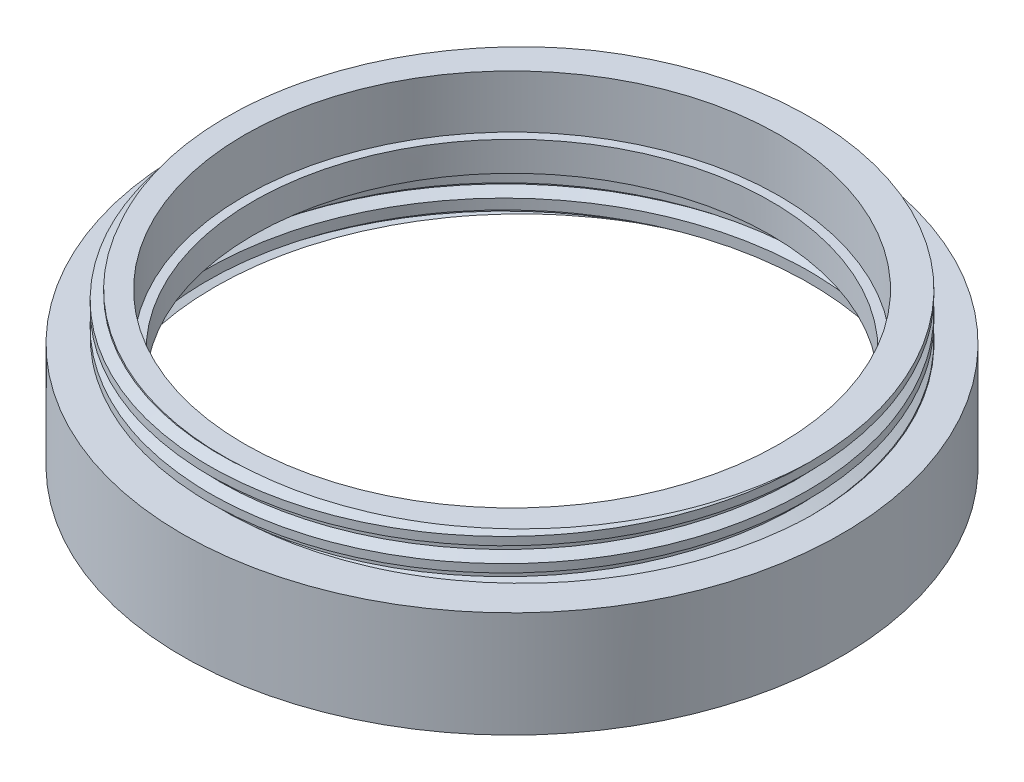
from build123d import *

# Parameters (mm, degrees)
SKETCH1_R           = 28
BOSS_EXTRUDE1_DEPTH = 2
SKETCH2_R           = 28
SKETCH2_R_2         = 22.74
SKETCH2_R_3         = 12.125
BOSS_EXTRUDE2_DEPTH = 15
SKETCH4_W           = 9
SKETCH4_H           = 5
CUT_EXTRUDE1_DEPTH  = 43.343830719
CUT_EXTRUDE2_START  = -5
SKETCH11_R          = 28
SKETCH11_R_2        = 25.35
CUT_EXTRUDE2_DEPTH  = 5
THREAD3_PITCH       = 2
SKETCH14_R          = 28
CUT_EXTRUDE3_DEPTH  = 2
SKETCH15_R          = 12.125
CUT_EXTRUDE4_DEPTH  = 43.343830887
SKETCH16_R          = 28
SKETCH16_R_2        = 22.74
CUT_EXTRUDE5_DEPTH  = 1
SKETCH17_R          = 28
CUT_EXTRUDE6_DEPTH  = 1
SKETCH18_R          = 28
SKETCH18_R_2        = 22.74
BOSS_EXTRUDE5_DEPTH = 3
SKETCH19_R          = 25.59
SKETCH19_R_2        = 22.74
CUT_EXTRUDE7_DEPTH  = 6
THREAD4_PITCH       = 2
SKETCH24_R          = 22.7625
SKETCH24_R_2        = 21.99
BOSS_EXTRUDE7_DEPTH = 2.5


with BuildPart() as part:
    # Sketch1 → Boss-Extrude1 (new body)
    with BuildSketch(Plane(origin=(0, 0, 0), x_dir=(1, 0, 0), z_dir=(0, 1, 0))):
        with Locations(Location((0, 0, 0), (0, 0, 270))):
            Circle(SKETCH1_R)
    extrude(amount=BOSS_EXTRUDE1_DEPTH)

    # Sketch2 → Boss-Extrude2 (add)
    # profile 1 of 2: a face of its own
    with BuildSketch(Plane(origin=(0, 2, 0), x_dir=(1, 0, 0), z_dir=(0, 1, 0))):
        with Locations(Location((0, 0, 0), (0, 0, 270))):
            Circle(SKETCH2_R)
        with Locations(Location((0, 0, 0), (0, 0, 270))):
            Circle(SKETCH2_R_2, mode=Mode.SUBTRACT)
    # profile 2 of 2: a face of its own
    with BuildSketch(Plane(origin=(0, 2, 0), x_dir=(1, 0, 0), z_dir=(0, 1, 0))):
        with Locations(Location((0, 0, 0), (0, 0, 270))):
            Circle(SKETCH2_R_3)
    extrude(amount=BOSS_EXTRUDE2_DEPTH)

    # Sketch4 → Cut-Extrude1 (cut, through all)
    with BuildSketch(Plane(origin=(0, 2, 0), x_dir=(1, 0, 0), z_dir=(0, 1, 0))):
        with Locations((16.625, 0)):
            Rectangle(SKETCH4_W, SKETCH4_H)
    extrude(amount=-CUT_EXTRUDE1_DEPTH, mode=Mode.SUBTRACT)

    # Sketch11 → Cut-Extrude2 (cut)
    with BuildSketch(Plane(origin=(0, 17, 0), x_dir=(1, 0, 0), z_dir=(0, 1, 0)).offset(CUT_EXTRUDE2_START)):
        with Locations(Location((0, 0, 0), (0, 0, 270))):
            Circle(SKETCH11_R)
        with Locations(Location((0, 0, 0), (0, 0, 270))):
            Circle(SKETCH11_R_2, mode=Mode.SUBTRACT)
    extrude(amount=CUT_EXTRUDE2_DEPTH, mode=Mode.SUBTRACT)

    # Thread3: arcs per turn and ends read off the stored shape
    # Thread3: the profile of Thread Profile3 profile screwed along a right-hand helix through 3.5 turns, 10 arcs to a turn; built about Z, then put on its axis
    thread3_z = Axis((0, 0, 0), (0, 0, 1))
    thread3_corners = [(-25.3503, 0, -7.000173205), (-25.3503, 0, -5.687326799), (-24.538101188, 0, -6.156250002), (-24.538101188, 0, -6.531250002)]
    with BuildLine(mode=Mode.PRIVATE) as thread3_profile:
        Line(thread3_corners[0], thread3_corners[1])
        Line(thread3_corners[1], thread3_corners[2])
        Line(thread3_corners[2], thread3_corners[3])
        Line(thread3_corners[3], thread3_corners[0])
    thread3_cap = Face(thread3_profile.wire())
    thread3_turn_angles = [0, 18, 36, 54, 72, 90, 108, 126, 144, 162, 180, 198, 216, 234, 252, 270, 288, 306, 324, 342, 360]
    thread3_turn_weights = [1, 0.9510565162951535, 1, 0.9510565162951535, 1, 0.9510565162951535, 1, 0.9510565162951535, 1, 0.9510565162951535, 1, 0.9510565162951535, 1, 0.9510565162951535, 1, 0.9510565162951535, 1, 0.9510565162951535, 1, 0.9510565162951535, 1]
    thread3_turn_rails = [Edge.make_bspline([Vector(p[0], p[1], 0).rotate(thread3_z, thread3_turn_angles[k]) / thread3_turn_weights[k] + Vector(0, 0, p[2] + THREAD3_PITCH * thread3_turn_angles[k] / 360) for k in range(21)], [0, 0, 0, 1, 1, 2, 2, 3, 3, 4, 4, 5, 5, 6, 6, 7, 7, 8, 8, 9, 9, 10, 10, 10], 2, thread3_turn_weights) for p in thread3_corners]
    thread3_turn_sides = [Face.make_surface_from_curves(thread3_turn_rails[p[0]], thread3_turn_rails[p[1]]) for p in [(0, 1), (1, 2), (2, 3), (3, 0)]]
    thread3_last_angles = [1080, 1098, 1116, 1134, 1152, 1170, 1188, 1206, 1224, 1242, 1260]
    thread3_last_weights = [1, 0.9510565162951535, 1, 0.9510565162951535, 1, 0.9510565162951535, 1, 0.9510565162951535, 1, 0.9510565162951535, 1]
    thread3_last_rails = [Edge.make_bspline([Vector(p[0], p[1], 0).rotate(thread3_z, thread3_last_angles[k]) / thread3_last_weights[k] + Vector(0, 0, p[2] + THREAD3_PITCH * thread3_last_angles[k] / 360) for k in range(11)], [0, 0, 0, 1, 1, 2, 2, 3, 3, 4, 4, 5, 5, 5], 2, thread3_last_weights) for p in thread3_corners]
    thread3_last_sides = [Face.make_surface_from_curves(thread3_last_rails[p[0]], thread3_last_rails[p[1]]) for p in [(0, 1), (1, 2), (2, 3), (3, 0)]]
    thread3 = Plane(origin=(0, 17, 0), x_dir=(-1, 0, 0), z_dir=(0, 1, 0)) * Solid(Shell([*[p.moved(Location((0, 0, THREAD3_PITCH * i))) for i in range(3) for p in thread3_turn_sides], *thread3_last_sides, thread3_cap, thread3_cap.rotate(thread3_z, 1260).moved(Location((0, 0, THREAD3_PITCH * 1260 / 360)))]))
    add(thread3, mode=Mode.SUBTRACT)

    # Sketch14 → Cut-Extrude3 (cut)
    with BuildSketch(Plane.XZ):
        with Locations(Location((0, 0, 0), (0, 0, 270))):
            Circle(SKETCH14_R)
    extrude(amount=-CUT_EXTRUDE3_DEPTH, mode=Mode.SUBTRACT)


with BuildPart() as cut_extrude3_piece_1:
    # of the separate pieces the step leaves, piece 1, a body of its own (cut_extrude3_pieces)
    add(part.part.solids().sort_by_distance((0, 12, 28))[0])

    # Sketch16 → Cut-Extrude5 (cut)
    with BuildSketch(Plane.XZ.offset(-2)):
        with Locations(Location((0, 0, 0), (0, 0, 270))):
            Circle(SKETCH16_R)
        with Locations(Location((0, 0, 0), (0, 0, 270))):
            Circle(SKETCH16_R_2, mode=Mode.SUBTRACT)
    extrude(amount=-CUT_EXTRUDE5_DEPTH, mode=Mode.SUBTRACT)

    # Sketch17 → Cut-Extrude6 (cut)
    with BuildSketch(Plane(origin=(0, 17, 0), x_dir=(1, 0, 0), z_dir=(0, 1, 0))):
        with Locations(Location((0, 0, 0), (0, 0, 90))):
            Circle(SKETCH17_R)
    extrude(amount=-CUT_EXTRUDE6_DEPTH, mode=Mode.SUBTRACT)

    # Sketch18 → Boss-Extrude5 (add)
    with BuildSketch(Plane(origin=(0, 12, 0), x_dir=(1, 0, 0), z_dir=(0, 1, 0))):
        with Locations(Location((0, 0, 0), (0, 0, 90))):
            Circle(SKETCH18_R)
        with Locations(Location((0, 0, 0), (0, 0, 90))):
            Circle(SKETCH18_R_2, mode=Mode.SUBTRACT)
    extrude(amount=-BOSS_EXTRUDE5_DEPTH)

    # Sketch19 → Cut-Extrude7 (cut)
    with BuildSketch(Plane.XZ.offset(-3)):
        with Locations(Location((0, 0, 0), (0, 0, 270))):
            Circle(SKETCH19_R)
        with Locations(Location((0, 0, 0), (0, 0, 270))):
            Circle(SKETCH19_R_2, mode=Mode.SUBTRACT)
    extrude(amount=-CUT_EXTRUDE7_DEPTH, mode=Mode.SUBTRACT)

    # Thread4: arcs per turn and ends read off the stored shape
    # Thread4: the profile of Thread Profile4 profile screwed along a right-hand helix through 3 turns, 10 arcs to a turn; built about Z, then put on its axis
    thread4_z = Axis((0, 0, 0), (0, 0, 1))
    thread4_corners = [(25.5897, 0, -6.000173205), (26.401898813, 0, -5.531250002), (26.401898813, 0, -5.343750002), (25.5897, 0, -4.874826799)]
    with BuildLine(mode=Mode.PRIVATE) as thread4_profile:
        Line(thread4_corners[0], thread4_corners[1])
        Line(thread4_corners[1], thread4_corners[2])
        Line(thread4_corners[2], thread4_corners[3])
        Line(thread4_corners[3], thread4_corners[0])
    thread4_cap = Face(thread4_profile.wire())
    thread4_turn_angles = [0, 18, 36, 54, 72, 90, 108, 126, 144, 162, 180, 198, 216, 234, 252, 270, 288, 306, 324, 342, 360]
    thread4_turn_weights = [1, 0.9510565162951535, 1, 0.9510565162951535, 1, 0.9510565162951535, 1, 0.9510565162951535, 1, 0.9510565162951535, 1, 0.9510565162951535, 1, 0.9510565162951535, 1, 0.9510565162951535, 1, 0.9510565162951535, 1, 0.9510565162951535, 1]
    thread4_turn_rails = [Edge.make_bspline([Vector(p[0], p[1], 0).rotate(thread4_z, thread4_turn_angles[k]) / thread4_turn_weights[k] + Vector(0, 0, p[2] + THREAD4_PITCH * thread4_turn_angles[k] / 360) for k in range(21)], [0, 0, 0, 1, 1, 2, 2, 3, 3, 4, 4, 5, 5, 6, 6, 7, 7, 8, 8, 9, 9, 10, 10, 10], 2, thread4_turn_weights) for p in thread4_corners]
    thread4_turn_sides = [Face.make_surface_from_curves(thread4_turn_rails[p[0]], thread4_turn_rails[p[1]]) for p in [(0, 1), (1, 2), (2, 3), (3, 0)]]
    thread4 = Plane(origin=(0, 3, 0), x_dir=(1, 0, 0), z_dir=(0, -1, 0)) * Solid(Shell([*[p.moved(Location((0, 0, THREAD4_PITCH * i))) for i in range(3) for p in thread4_turn_sides], thread4_cap, thread4_cap.rotate(thread4_z, 1080).moved(Location((0, 0, THREAD4_PITCH * 1080 / 360)))]))
    add(thread4, mode=Mode.SUBTRACT)


with BuildPart() as cut_extrude3_piece_2:
    # of the separate pieces the step leaves, piece 2, a body of its own (cut_extrude3_pieces)
    add(part.part.solids().sort_by_distance((0, 2, 12.125))[0])

    # Sketch15 → Cut-Extrude4 (cut, through all)
    with BuildSketch(Plane.XZ.offset(-2)):
        Circle(SKETCH15_R)
    extrude(amount=-CUT_EXTRUDE4_DEPTH, mode=Mode.SUBTRACT)


with BuildPart() as body_2:
    # Sketch24 → Boss-Extrude7 (new body)
    with BuildSketch(Plane(origin=(0, 11.5, 0), x_dir=(1, 0, 0), z_dir=(0, 1, 0))):
        with Locations(Location((0, 0, 0), (0, 0, 270))):
            Circle(SKETCH24_R)
        with Locations(Location((0, 0, 0), (0, 0, 270))):
            Circle(SKETCH24_R_2, mode=Mode.SUBTRACT)
    extrude(amount=-BOSS_EXTRUDE7_DEPTH)


solid = Compound([cut_extrude3_piece_1.part, body_2.part])
